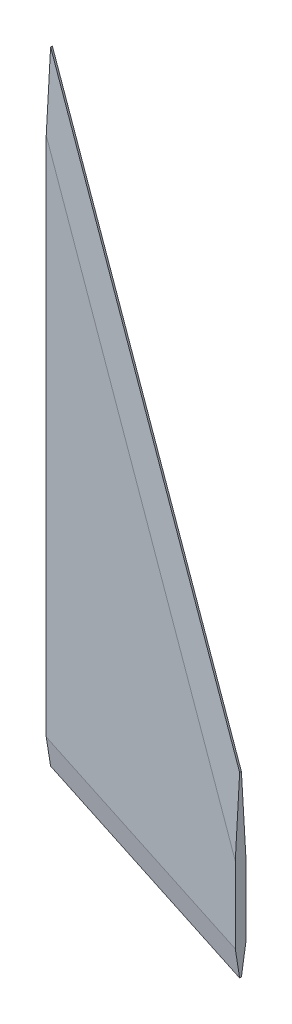
from build123d import *
from OCP.BRepFilletAPI import BRepFilletAPI_MakeChamfer

# Parameters (mm, degrees)
BOSS_EXTRUDE1_DEPTH = 1.5
CHAMFER1_SIZE       = 1.25
CHAMFER1_SIZE2      = 7.089102275


with BuildPart() as part:
    # Sketch1 → Boss-Extrude1 (new, symmetric)
    with BuildSketch(Plane.XY):
        Polygon((-16.410036231, -42.153112058), (-16.410036231, 135.646887942), (37.564963769, -16.753112058), (37.564963769, -67.553112058), align=None)
    extrude(amount=BOSS_EXTRUDE1_DEPTH, both=True)

    # Chamfer1: one chamfer whose edges measure the first distance from different faces: ONE call of the kernel's chamfer builder (chamfer() names one face for all edges)
    chamfer1_edges_1 = [part.edges().sort_by_distance(p)[0] for p in [
        (10.577463769, -54.853112058, -1.5),
        (10.577463769, -54.853112058, 1.5),
    ]]
    chamfer1_side_1 = [part.faces().sort_by_distance(p)[0] for p in [
        (10.577463769, -54.853112058, 0),
    ]]
    chamfer1_edges_2 = [part.edges().sort_by_distance(p)[0] for p in [
        (10.577463769, 59.446887942, -1.5),
        (10.577463769, 59.446887942, 1.5),
    ]]
    chamfer1_side_2 = [part.faces().sort_by_distance(p)[0] for p in [
        (10.577463769, 59.446887942, 0),
    ]]
    chamfer1 = BRepFilletAPI_MakeChamfer(part.part.solid().wrapped)
    for e in chamfer1_edges_1:
        chamfer1.Add(CHAMFER1_SIZE, CHAMFER1_SIZE2, e.wrapped, chamfer1_side_1[0].wrapped)  # the first distance lies on this face
    for e in chamfer1_edges_2:
        chamfer1.Add(CHAMFER1_SIZE, CHAMFER1_SIZE2, e.wrapped, chamfer1_side_2[0].wrapped)  # the first distance lies on this face
    add(Compound.cast(chamfer1.Shape()), mode=Mode.REPLACE)


solid = part.part
